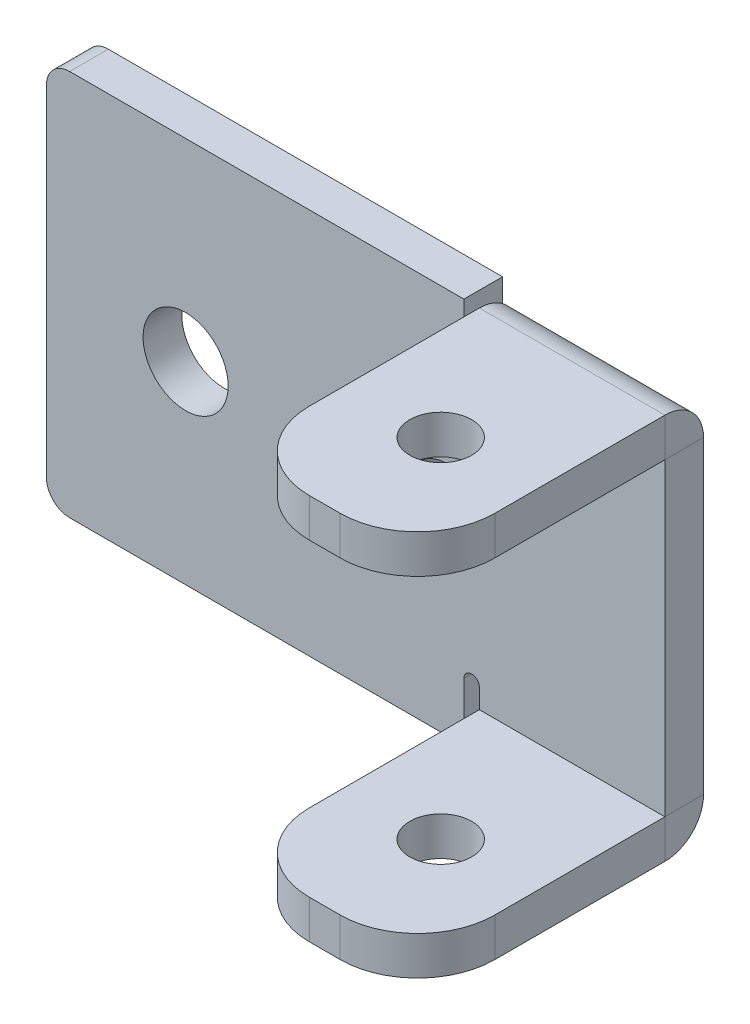
from build123d import *

# Parameters (mm, degrees)
SCHIZZO1_R                 = 2.75
BASE_FLANGIA1_DEPTH        = 2.5
BORDO_FLANGIA1_START       = -2.5
BORDO_FLANGIA1_DEPTH       = 2.5
BORDO_FLANGIA1_2_OUTLINE_W = 12
BORDO_FLANGIA1_2_OUTLINE_H = 2.5
BORDO_FLANGIA1_2_DEPTH     = 16
BORDO_FLANGIA1_START_2     = 8
BORDO_FLANGIA1_3_DEPTH     = 13
SCHIZZO12_R                = 2
TAGLIO_ESTRUSIONE1_DEPTH   = 25
TAGLIO_ESTRUSIONE2_DEPTH   = 25


with BuildPart() as part:
    # Base-Flangia1: sheet metal written as solids
    # Schizzo1 → Base-Flangia1 (new body)
    with BuildSketch(Plane.XY):
        with BuildLine():
            Line((20, -12.5), (-18.5, -12.5))
            ThreePointArc((-18.5, -12.5), (-19.560660172, -12.060660172), (-20, -11))
            Line((-20, -11), (-20, 11))
            ThreePointArc((-20, 11), (-19.560660172, 12.060660172), (-18.5, 12.5))
            Line((-18.5, 12.5), (20, 12.5))
            Line((20, 12.5), (20, -12.5))
        make_face()
        with Locations((-11, 0)):
            Circle(SCHIZZO1_R, mode=Mode.SUBTRACT)
        with Locations((6, 0)):
            Circle(SCHIZZO1_R, mode=Mode.SUBTRACT)
    extrude(amount=-BASE_FLANGIA1_DEPTH)

    # Bordo-Flangia1: read off the stored shape, not the designer's step
    # Bordo-Flangia1 outline → Bordo-Flangia1 (cut)
    with BuildSketch(Plane.XY.offset(BORDO_FLANGIA1_START)):
        with BuildLine():
            Line((8, 8.75), (8, 12.5))
            Line((8, 12.5), (7, 12.5))
            Line((7, 12.5), (7, 8.75))
            ThreePointArc((7, 8.75), (7.5, 8.25), (8, 8.75))
        make_face()
        with BuildLine():
            Line((8, -12.5), (8, -8.75))
            ThreePointArc((8, -8.75), (7.5, -8.25), (7, -8.75))
            Line((7, -8.75), (7, -12.5))
            Line((7, -12.5), (8, -12.5))
        make_face()
    extrude(amount=BORDO_FLANGIA1_DEPTH, mode=Mode.SUBTRACT)

    # Bordo-Flangia1 2 outline → Bordo-Flangia1 2 (add)
    with BuildSketch(Plane.XY):
        with Locations((14, 11.25)):
            Rectangle(BORDO_FLANGIA1_2_OUTLINE_W, BORDO_FLANGIA1_2_OUTLINE_H)
        with Locations((14, -11.25)):
            Rectangle(BORDO_FLANGIA1_2_OUTLINE_W, BORDO_FLANGIA1_2_OUTLINE_H)
    extrude(amount=BORDO_FLANGIA1_2_DEPTH)

    # Bordo-Flangia1 3 outline → Bordo-Flangia1 3 (cut)
    with BuildSketch(Plane.YZ.offset(BORDO_FLANGIA1_START_2)):
        with BuildLine():
            Line((-12.5, -2.5), (-10, -2.5))
            ThreePointArc((-10, -2.5), (-11.767766953, -1.767766953), (-12.5, 0))
            Line((-12.5, 0), (-12.5, -2.5))
        make_face()
        with BuildLine():
            ThreePointArc((12.5, 0), (11.767766953, -1.767766953), (10, -2.5))
            Line((10, -2.5), (12.5, -2.5))
            Line((12.5, -2.5), (12.5, 0))
        make_face()
    extrude(amount=BORDO_FLANGIA1_3_DEPTH, mode=Mode.SUBTRACT)

    # Schizzo12 → Taglio-Estrusione1 (cut)
    with BuildSketch(Plane.XZ.offset(12.5)):
        with Locations(Location((14, 8.5, 0), (0, 0, 270))):
            Circle(SCHIZZO12_R)
    extrude(amount=-TAGLIO_ESTRUSIONE1_DEPTH, mode=Mode.SUBTRACT)

    # Schizzo13 → Taglio-Estrusione2 (cut)
    with BuildSketch(Plane.XZ.offset(12.5)):
        with BuildLine():
            Line((8, 11), (8, 16))
            Line((8, 16), (13, 16))
            ThreePointArc((13, 16), (9.464466094, 14.535533906), (8, 11))
        make_face()
        with BuildLine():
            Line((20, 16), (20, 11))
            ThreePointArc((20, 11), (18.535533906, 14.535533906), (15, 16))
            Line((15, 16), (20, 16))
        make_face()
    extrude(amount=-TAGLIO_ESTRUSIONE2_DEPTH, mode=Mode.SUBTRACT)


solid = part.part
